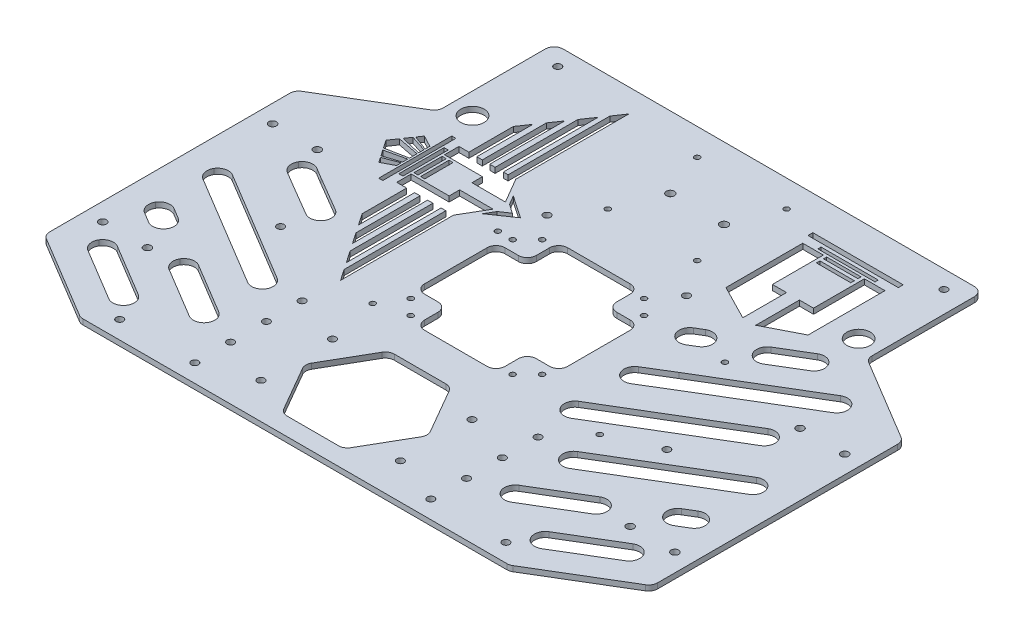
from build123d import *

# Parameters (mm, degrees)
SKETCH_1_W                  = 340
SKETCH_1_H                  = 265
EXTRUDE_1_DEPTH             = 3
HOLE_WIZARD_4_0_4_4_D       = 4
PATTERN_LINEAR_1_COUNT      = 4
PATTERN_LINEAR_1_PITCH      = 20
PATTERN_LINEAR_1_COUNT_DIR2 = 2
PATTERN_LINEAR_1_PITCH_DIR2 = 132
HOLE_WIZARD_4_2_4_2_1_D     = 4.2
PATTERN_LINEAR_2_COUNT      = 2
PATTERN_LINEAR_2_PITCH      = 95
PATTERN_LINEAR_2_COUNT_DIR2 = 2
PATTERN_LINEAR_2_PITCH_DIR2 = 25
MIRROR_1_COPY_1_D           = 4.2
MIRROR_1_COPY_2_D           = 4.2
MIRROR_1_COPY_3_D           = 4.2
HOLE_WIZARD_4_0_4_1_D       = 4
CUT_EXTRUDE_1_DEPTH         = 3
HOLE_WIZARD_4_0_4_2_D       = 4
CUT_EXTRUDE_2_DEPTH         = 3
HOLE_WIZARD_3_0_3_1_D       = 3
PATTERN_LINEAR_3_COUNT      = 2
PATTERN_LINEAR_3_PITCH      = 73.5
PATTERN_LINEAR_3_COUNT_DIR2 = 2
PATTERN_LINEAR_3_PITCH_DIR2 = 57
PATTERN_CIRCULAR_2_COUNT    = 2
PATTERN_CIRCULAR_2_ANGLE    = 90
PATTERN_CIRCULAR_2_COPY_1_D = 3
PATTERN_CIRCULAR_2_COPY_2_D = 3
PATTERN_CIRCULAR_2_COPY_3_D = 3
HOLE_WIZARD_3_0_3_2_D       = 3
PATTERN_LINEAR_4_COUNT      = 2
PATTERN_LINEAR_4_PITCH      = 50
PATTERN_LINEAR_4_COUNT_DIR2 = 2
PATTERN_LINEAR_4_PITCH_DIR2 = 50
HOLE_WIZARD_4_5_4_5_1_D     = 4.5
SKETCH_20_W                 = 2.304
SKETCH_20_H                 = 7.929183637
SKETCH_20_H_2               = 12.65440487
SKETCH_20_H_3               = 12.654404871
SKETCH_20_H_4               = 20.44628026
CUT_EXTRUDE_3_DEPTH         = 3
CUT_EXTRUDE_4_DEPTH         = 3
HOLE_WIZARD_4_0_4_3_D       = 4
PATTERN_LINEAR_5_COUNT      = 2
PATTERN_LINEAR_5_PITCH      = 40
MIRROR_5_COPY_1_D           = 4
PATTERN_LINEAR_6_COUNT      = 2
PATTERN_LINEAR_6_PITCH      = 160
MIRROR_6_COPY_1_D           = 4
MIRROR_6_COPY_2_D           = 4
HOLE_WIZARD_13_0_13_1_D     = 13
HOLE_WIZARD_3_0_3_3_D       = 3
PATTERN_LINEAR_7_COUNT      = 2
PATTERN_LINEAR_7_PITCH      = 127
PATTERN_LINEAR_7_COUNT_DIR2 = 2
PATTERN_LINEAR_7_PITCH_DIR2 = 70
SKETCH_29_W                 = 9.614339975
SKETCH_29_H                 = 1.991198393
SKETCH_29_W_2               = 9.614339974
SKETCH_29_H_2               = 1.777126463
SKETCH_29_W_3               = 15.997707498
SKETCH_29_H_3               = 1.813029874
SKETCH_29_W_4               = 15.997707497
SKETCH_29_W_5               = 25.261157005
SKETCH_29_H_4               = 2.747873401
CUT_EXTRUDE_5_DEPTH         = 3
CUT_EXTRUDE_2_2_DEPTH       = 3
FILLET_1_R                  = 6
FILLET_2_R                  = 5


with BuildPart() as part:
    # 草图1 → 凸台-拉伸1 (new body)
    with BuildSketch(Plane(origin=(0, 0, 0), x_dir=(1, 0, 0), z_dir=(0, 1, 0))):
        with Locations((0, 92.5)):
            Rectangle(SKETCH_1_W, SKETCH_1_H)
    extrude(amount=EXTRUDE_1_DEPTH)

    # Ø4.0 (4) 直径孔4 (through all)
    with Locations(Plane(origin=(0, 3, 0), x_dir=(1, 0, 0), z_dir=(0, 1, 0))):
        with Locations((66, -30)):
            hole_wizard_4_0_4_4 = Hole(HOLE_WIZARD_4_0_4_4_D / 2)

    # 阵列(线性)1: Hole Wizard 4.0 _4_ _4 4 × 2
    with Locations(*[(-j * PATTERN_LINEAR_1_PITCH_DIR2, 0, -i * PATTERN_LINEAR_1_PITCH) for i in range(PATTERN_LINEAR_1_COUNT) for j in range(PATTERN_LINEAR_1_COUNT_DIR2) if (i, j) != (0, 0)]):
        add(hole_wizard_4_0_4_4, mode=Mode.SUBTRACT)

    # Ø4.2 (4.2) 直径孔1 (through all)
    with Locations(Plane(origin=(0, 3, 0), x_dir=(1, 0, 0), z_dir=(0, 1, 0))):
        with Locations((160, 107.5)):
            hole_wizard_4_2_4_2_1 = Hole(HOLE_WIZARD_4_2_4_2_1_D / 2)

    # 阵列(线性)2: Hole Wizard 4.2 _4.2_ _1 2 × 2
    with Locations(*[(-j * PATTERN_LINEAR_2_PITCH_DIR2, 0, i * PATTERN_LINEAR_2_PITCH) for i in range(PATTERN_LINEAR_2_COUNT) for j in range(PATTERN_LINEAR_2_COUNT_DIR2) if (i, j) != (0, 0)]):
        add(hole_wizard_4_2_4_2_1, mode=Mode.SUBTRACT)

    # 镜向1: Ø4.2 (4.2) 直径孔1 across plane
    add(hole_wizard_4_2_4_2_1.mirror(Plane(origin=(0, 0, 0), x_dir=(0, 0, 1), z_dir=(1, 0, 0))), mode=Mode.SUBTRACT)

    # 镜向1 copy 1 (through all)
    with Locations(Plane(origin=(25, 3, 0), x_dir=(-1, 0, 0), z_dir=(0, 1, 0))):
        with Locations((160, -107.5)):
            Hole(MIRROR_1_COPY_1_D / 2)

    # 镜向1 copy 2 (through all)
    with Locations(Plane(origin=(0, 3, 95), x_dir=(-1, 0, 0), z_dir=(0, 1, 0))):
        with Locations((160, -107.5)):
            Hole(MIRROR_1_COPY_2_D / 2)

    # 镜向1 copy 3 (through all)
    with Locations(Plane(origin=(25, 3, 95), x_dir=(-1, 0, 0), z_dir=(0, 1, 0))):
        with Locations((160, -107.5)):
            Hole(MIRROR_1_COPY_3_D / 2)

    # Ø4.0 (4) 直径孔1 (through all)
    with Locations(Plane(origin=(0, 3, 0), x_dir=(1, 0, 0), z_dir=(0, 1, 0))):
        with Locations((108, -30), (108, 60)):
            hole_wizard_4_0_4_1 = Hole(HOLE_WIZARD_4_0_4_1_D / 2)

    # 镜向2: Ø4.0 (4) 直径孔1 across plane
    add(hole_wizard_4_0_4_1.mirror(Plane(origin=(0, 0, 0), x_dir=(0, 0, 1), z_dir=(1, 0, 0))), mode=Mode.SUBTRACT)

    # 草图8 → 切除-拉伸1 (cut)
    with BuildSketch(Plane(origin=(0, 3, 0), x_dir=(1, 0, 0), z_dir=(0, 1, 0))):
        Polygon((-170, -40), (-120, -40), (-170, -10), align=None)
        Polygon((-120, 160), (-120, 225), (-170, 225), (-170, 160), (-170, 130), align=None)
    cut_extrude_1 = extrude(amount=-CUT_EXTRUDE_1_DEPTH, mode=Mode.SUBTRACT)

    # 镜向3: 切除-拉伸1 across plane
    add(cut_extrude_1.mirror(Plane(origin=(0, 0, 0), x_dir=(0, 0, 1), z_dir=(1, 0, 0))), mode=Mode.SUBTRACT)

    # Ø4.0 (4) 直径孔2 (through all)
    with Locations(Plane(origin=(0, 3, 0), x_dir=(1, 0, 0), z_dir=(0, 1, 0))):
        with Locations((108, 215)):
            hole_wizard_4_0_4_2 = Hole(HOLE_WIZARD_4_0_4_2_D / 2)

    # 镜向4: Ø4.0 (4) 直径孔2 across plane
    add(hole_wizard_4_0_4_2.mirror(Plane(origin=(0, 0, 0), x_dir=(0, 0, 1), z_dir=(1, 0, 0))), mode=Mode.SUBTRACT)

    # 草图13 → Cut-Extrude 2 (cut)
    with BuildSketch(Plane(origin=(0, 3, 0), x_dir=(1, 0, 0), z_dir=(0, 1, 0))):
        Polygon((22.5, 50), (0, 50), (-22.5, 50), (-22.5, 130), (22.5, 130), align=None)
    cut_extrude_2 = extrude(amount=-CUT_EXTRUDE_2_DEPTH, mode=Mode.SUBTRACT)

    # Ø3.0 (3) 直径孔1 (through all)
    with Locations(Plane(origin=(0, 3, 0), x_dir=(1, 0, 0), z_dir=(0, 1, 0))):
        with Locations((28.5, 126.75)):
            hole_wizard_3_0_3_1 = Hole(HOLE_WIZARD_3_0_3_1_D / 2)

    # 阵列(线性)3: Hole Wizard 3.0 _3_ _1 2 × 2
    with Locations(*[(-j * PATTERN_LINEAR_3_PITCH_DIR2, 0, i * PATTERN_LINEAR_3_PITCH) for i in range(PATTERN_LINEAR_3_COUNT) for j in range(PATTERN_LINEAR_3_COUNT_DIR2) if (i, j) != (0, 0)]):
        add(hole_wizard_3_0_3_1, mode=Mode.SUBTRACT)

    # 阵列(圆周)2: Cut-Extrude 2, Ø3.0 (3) 直径孔1 ×2 about axis
    pattern_circular_2_axis = Axis((0, 0, -90), (0, 1, 0))
    add([cut_extrude_2.rotate(pattern_circular_2_axis, i * PATTERN_CIRCULAR_2_ANGLE / (PATTERN_CIRCULAR_2_COUNT - 1)) for i in range(1, PATTERN_CIRCULAR_2_COUNT)], mode=Mode.SUBTRACT)
    add([hole_wizard_3_0_3_1.rotate(pattern_circular_2_axis, i * PATTERN_CIRCULAR_2_ANGLE / (PATTERN_CIRCULAR_2_COUNT - 1)) for i in range(1, PATTERN_CIRCULAR_2_COUNT)], mode=Mode.SUBTRACT)

    # 阵列(圆周)2 copy 1 (through all)
    with Locations(Plane(origin=(90, 3, -33), x_dir=(0, 0, -1), z_dir=(0, 1, 0))):
        with Locations((28.5, 126.75)):
            Hole(PATTERN_CIRCULAR_2_COPY_1_D / 2)

    # 阵列(圆周)2 copy 2 (through all)
    with Locations(Plane(origin=(163.5, 3, -90), x_dir=(0, 0, -1), z_dir=(0, 1, 0))):
        with Locations((28.5, 126.75)):
            Hole(PATTERN_CIRCULAR_2_COPY_2_D / 2)

    # 阵列(圆周)2 copy 3 (through all)
    with Locations(Plane(origin=(163.5, 3, -33), x_dir=(0, 0, -1), z_dir=(0, 1, 0))):
        with Locations((28.5, 126.75)):
            Hole(PATTERN_CIRCULAR_2_COPY_3_D / 2)

    # Ø3.0 (3) 直径孔2 (through all)
    with Locations(Plane(origin=(0, 3, 0), x_dir=(1, 0, 0), z_dir=(0, 1, 0))):
        with Locations((-25, 210)):
            hole_wizard_3_0_3_2 = Hole(HOLE_WIZARD_3_0_3_2_D / 2)

    # 阵列(线性)4: Hole Wizard 3.0 _3_ _2 2 × 2
    with Locations(*[(j * PATTERN_LINEAR_4_PITCH_DIR2, 0, i * PATTERN_LINEAR_4_PITCH) for i in range(PATTERN_LINEAR_4_COUNT) for j in range(PATTERN_LINEAR_4_COUNT_DIR2) if (i, j) != (0, 0)]):
        add(hole_wizard_3_0_3_2, mode=Mode.SUBTRACT)

    # Ø4.5 (4.5) 直径孔1 (through all)
    with Locations(Plane(origin=(0, 3, 0), x_dir=(1, 0, 0), z_dir=(0, 1, 0))):
        with Locations((15, 185), (-15, 185)):
            Hole(HOLE_WIZARD_4_5_4_5_1_D / 2)

    # 草图20 → 切除-拉伸3 (cut)
    with BuildSketch(Plane(origin=(0, 3, 0), x_dir=(1, 0, 0), z_dir=(0, 1, 0))):
        Polygon((-65.161915682, 211.869982225), (-69.447641611, 205.611932631), (-69.447641611, 148.677537629), (-65.161915682, 148.677537629), align=None)
        Polygon((-75.708296812, 134.728942545), (-57.004498885, 134.728942545), (-65.161915682, 148.677537629), (-96.948202991, 148.677537629), (-96.948202991, 140.593692762), (-75.708296812, 140.593692762), align=None)
        Polygon((-65.161915682, 113.882056967), (-96.948202991, 113.882056967), (-96.948202991, 121.965901834), (-75.708296812, 121.965901834), (-75.708296812, 127.830652051), (-57.004498885, 127.830652051), align=None)
        Polygon((-49.125427231, 131.279797298), (-49.674785213, 131.279797298), (-54.711253333, 127.830652051), (-57.779878264, 122.62953623), (-45.148701269, 131.279797298), align=None)
        Polygon((-54.711253333, 134.728942545), (-49.674785213, 131.279797298), (-49.125427231, 131.279797298), (-45.148701269, 131.279797298), (-57.779878264, 139.930058366), align=None)
        Polygon((-72.126923578, 201.699624727), (-76.714154658, 195.001315019), (-76.714154658, 148.677537629), (-72.126923578, 148.677537629), align=None)
        Polygon((-79.701188849, 190.639624977), (-83.883036718, 184.533258918), (-83.883036718, 148.677537629), (-79.701188849, 148.677537629), align=None)
        Polygon((-86.955414743, 180.04694916), (-91.393294113, 173.566723954), (-91.393294113, 148.677537629), (-86.955414743, 148.677537629), align=None)
        Polygon((-91.393294113, 113.882056967), (-91.393294113, 88.992870642), (-86.955414743, 82.512645436), (-86.955414743, 113.882056967), align=None)
        Polygon((-83.883036718, 113.882056967), (-83.883036718, 78.026335678), (-79.701188849, 71.919969619), (-79.701188849, 113.882056967), align=None)
        Polygon((-76.714154658, 113.882056967), (-76.714154658, 67.558279577), (-72.126923578, 60.859969869), (-72.126923578, 113.882056967), align=None)
        Polygon((-69.447641611, 113.882056967), (-69.447641611, 56.947661965), (-65.161915682, 50.689612371), (-65.161915682, 113.882056967), align=None)
        with Locations((-91.914025093, 135.244389117)):
            Rectangle(SKETCH_20_W, SKETCH_20_H)
        with Locations((-91.914025093, 127.31520548)):
            Rectangle(SKETCH_20_W, SKETCH_20_H)
        with Locations((-99.360275881, 124.952594863)):
            Rectangle(SKETCH_20_W, SKETCH_20_H_2)
        with Locations((-99.360275881, 137.606999734)):
            Rectangle(SKETCH_20_W, SKETCH_20_H_3)
        with Locations((-102.854015262, 121.056657168)):
            Rectangle(SKETCH_20_W, SKETCH_20_H_4)
        with Locations((-102.854015262, 141.502937428)):
            Rectangle(SKETCH_20_W, SKETCH_20_H_4)
        Polygon((-111.626480361, 144.022071525), (-113.599808452, 141.14060284), (-105.122164665, 137.943905858), (-105.122164665, 140.601426815), align=None)
        Polygon((-114.21278578, 140.245528684), (-116.487410172, 136.924104848), (-105.122164665, 134.302998856), (-105.122164665, 137.261955913), align=None)
        Polygon((-120.352824605, 131.279797298), (-105.122164681, 131.279797298), (-105.122164681, 133.373561182), (-117.287622567, 135.755628624), align=None)
        Polygon((-105.122164681, 129.186033414), (-105.122164681, 131.279797298), (-120.352824605, 131.279797298), (-117.287622567, 126.803965972), align=None)
        Polygon((-105.122164665, 128.256595741), (-116.487410164, 125.635489753), (-114.21278578, 122.314065912), (-105.122164665, 125.297638683), align=None)
        Polygon((-105.122164665, 124.615688738), (-113.599808452, 121.418991756), (-111.626480361, 118.537523071), (-105.122164665, 121.958167781), align=None)
        with Locations((-95.683692637, 127.31520548)):
            Rectangle(SKETCH_20_W, SKETCH_20_H)
        with Locations((-95.683692637, 135.244389117)):
            Rectangle(SKETCH_20_W, SKETCH_20_H)
    extrude(amount=-CUT_EXTRUDE_3_DEPTH, mode=Mode.SUBTRACT)

    # 草图21 → 切除-拉伸4 (cut)
    with BuildSketch(Plane(origin=(0, 3, 0), x_dir=(1, 0, 0), z_dir=(0, 1, 0))):
        Polygon((34.641016151, 0), (17.320508076, 30), (-17.320508076, 30), (-34.641016151, 0), (-17.320508076, -30), (17.320508076, -30), align=None)
    extrude(amount=-CUT_EXTRUDE_4_DEPTH, mode=Mode.SUBTRACT)

    # Ø4.0 (4) 直径孔3 (through all)
    with Locations(Plane(origin=(0, 3, 0), x_dir=(1, 0, 0), z_dir=(0, 1, 0))):
        with Locations((39, -20)):
            hole_wizard_4_0_4_3 = Hole(HOLE_WIZARD_4_0_4_3_D / 2)

    # 阵列(线性)5: Ø4.0 (4) 直径孔3 ×2
    with Locations(*[(0, 0, -i * PATTERN_LINEAR_5_PITCH) for i in range(1, PATTERN_LINEAR_5_COUNT)]):
        add(hole_wizard_4_0_4_3, mode=Mode.SUBTRACT)

    # 镜向5: Ø4.0 (4) 直径孔3 across plane
    add(hole_wizard_4_0_4_3.mirror(Plane(origin=(0, 0, 0), x_dir=(0, 0, 1), z_dir=(1, 0, 0))), mode=Mode.SUBTRACT)

    # 镜向5 copy 1 (through all)
    with Locations(Plane(origin=(0, 3, -40), x_dir=(-1, 0, 0), z_dir=(0, 1, 0))):
        with Locations((39, 20)):
            Hole(MIRROR_5_COPY_1_D / 2)

    # 阵列(线性)6: Ø4.0 (4) 直径孔3 ×2
    with Locations(*[(0, 0, -i * PATTERN_LINEAR_6_PITCH) for i in range(1, PATTERN_LINEAR_6_COUNT)]):
        add(hole_wizard_4_0_4_3, mode=Mode.SUBTRACT)

    # 镜向6 copy 1 (through all)
    with Locations(Plane(origin=(0, 3, -160), x_dir=(-1, 0, 0), z_dir=(0, 1, 0))):
        with Locations((39, 20)):
            Hole(MIRROR_6_COPY_1_D / 2)

    # 镜向6 copy 2 (through all)
    with Locations(Plane(origin=(0, 3, 0), x_dir=(-1, 0, 0), z_dir=(0, 1, 0))):
        with Locations((39, 20)):
            Hole(MIRROR_6_COPY_2_D / 2)

    # Ø13.0 (13) 直径孔1 (through all)
    with Locations(Plane(origin=(0, 3, 0), x_dir=(1, 0, 0), z_dir=(0, 1, 0))):
        with Locations((-108, 167.3)):
            hole_wizard_13_0_13_1 = Hole(HOLE_WIZARD_13_0_13_1_D / 2)

    # 镜向7: Ø13.0 (13) 直径孔1 across plane
    add(hole_wizard_13_0_13_1.mirror(Plane(origin=(0, 0, 0), x_dir=(0, 0, 1), z_dir=(1, 0, 0))), mode=Mode.SUBTRACT)

    # Ø3.0 (3) 直径孔3 (through all)
    with Locations(Plane(origin=(0, 3, 0), x_dir=(1, 0, 0), z_dir=(0, 1, 0))):
        with Locations((-45, 118.5)):
            hole_wizard_3_0_3_3 = Hole(HOLE_WIZARD_3_0_3_3_D / 2)

    # 阵列(线性)7: Hole Wizard 3.0 _3_ _3 2 × 2
    with Locations(*[(i * PATTERN_LINEAR_7_PITCH, 0, j * PATTERN_LINEAR_7_PITCH_DIR2) for i in range(PATTERN_LINEAR_7_COUNT) for j in range(PATTERN_LINEAR_7_COUNT_DIR2) if (i, j) != (0, 0)]):
        add(hole_wizard_3_0_3_3, mode=Mode.SUBTRACT)

    # 草图29 → 切除-拉伸5 (cut)
    with BuildSketch(Plane(origin=(0, 3, 0), x_dir=(1, 0, 0), z_dir=(0, 1, 0))):
        Polygon((72.691668195, 169.494821887), (72.691668195, 145.036075879), (92.064932359, 154.964873764), (92.064932359, 197.949303628), (80.562056761, 197.949303628), (80.562056761, 169.494821887), align=None)
        Polygon((46.091443896, 154.964873764), (46.091443896, 197.949303628), (57.594319494, 197.949303628), (57.594319494, 169.494821887), (65.464708061, 169.494821887), (65.464708061, 145.036075879), align=None)
        with Locations((64.271018141, 193.196665814)):
            Rectangle(SKETCH_29_W, SKETCH_29_H)
        with Locations((73.885358115, 193.196665814)):
            Rectangle(SKETCH_29_W_2, SKETCH_29_H)
        with Locations((73.885358115, 197.060740397)):
            Rectangle(SKETCH_29_W_2, SKETCH_29_H_2)
        with Locations((64.271018141, 197.060740397)):
            Rectangle(SKETCH_29_W, SKETCH_29_H_2)
        with Locations((61.079334379, 200.300217856)):
            Rectangle(SKETCH_29_W_3, SKETCH_29_H_3)
        with Locations((77.077041877, 200.300217856)):
            Rectangle(SKETCH_29_W_4, SKETCH_29_H_3)
        with Locations((81.708766631, 204.507013734)):
            Rectangle(SKETCH_29_W_5, SKETCH_29_H_4)
        with Locations((56.447609626, 204.507013734)):
            Rectangle(SKETCH_29_W_5, SKETCH_29_H_4)
    extrude(amount=-CUT_EXTRUDE_5_DEPTH, mode=Mode.SUBTRACT)

    # 草图35 → Cut-Extrude 2 2 (cut)
    with BuildSketch(Plane(origin=(0, 3, 0), x_dir=(1, 0, 0), z_dir=(0, 1, 0))):
        Polygon((149.289050759, 7.894380308), (144.706679502, 5.144957554), (119.237536666, -10.136528147), (109.711275714, -15.852284718), (115.88522478, -26.142199827), (125.411485731, -20.426443256), (150.880628567, -5.144957554), (155.462999824, -2.3955348), align=None)
        Polygon((84.973005474, -12.036200799), (123.560187131, 11.116108195), (117.386238066, 21.406023304), (78.799056408, -1.746285691), align=None)
        Polygon((151.720036271, 74.659632838), (121.215178407, 56.35671812), (78.799056408, 30.907044921), (84.973005474, 20.617129812), (127.389127472, 46.066803011), (157.893985336, 64.36971773), align=None)
        Polygon((141.795008624, 22.057001091), (157.893985336, 31.716387118), (151.720036271, 42.006302227), (135.621059559, 32.3469162), align=None)
        Polygon((61.043493643, 45.326469941), (126.764003744, 84.758776002), (137.474694879, 91.185190683), (131.300745814, 101.475105791), (120.590054679, 95.04869111), (54.869544578, 55.61638505), align=None)
        Polygon((135.621059559, 137.689997296), (123.991330618, 130.712159931), (96.343698757, 114.123580815), (74.085335875, 100.768563085), (54.82901061, 89.006962889), (61.08402761, 78.766124919), (80.299915801, 90.503026493), (102.517647823, 103.833665706), (130.165279683, 120.422244822), (141.795008624, 127.400082187), align=None)
        Polygon((57.602980489, 113.022856021), (72.008861641, 121.666384712), (65.834912576, 131.956299821), (51.429031424, 123.31277113), align=None)
        Polygon((88.55677931, 125.39581952), (115.066971876, 141.30193506), (108.893022811, 151.591850168), (82.382830244, 135.685734628), align=None)
        Polygon((-95.662009122, 80.393940838), (-120.613077507, 95.062504808), (-131.300745814, 101.475105791), (-137.474694879, 91.185190683), (-126.740980915, 84.744962305), (-101.743621466, 70.049184133), align=None)
        Polygon((-78.799056408, 30.907044921), (-121.215178407, 56.35671812), (-151.720036271, 74.659632838), (-157.893985336, 64.36971773), (-127.389127472, 46.066803011), (-84.973005474, 20.617129812), align=None)
        Polygon((-135.621059559, 32.3469162), (-151.720036271, 42.006302227), (-157.893985336, 31.716387118), (-141.795008624, 22.057001091), align=None)
        Polygon((-78.799056408, -1.746285691), (-117.386238066, 21.406023304), (-123.560187131, 11.116108195), (-84.973005474, -12.036200799), align=None)
        Polygon((-109.711275714, -15.852284718), (-119.237536666, -10.136528147), (-144.706679502, 5.144957554), (-149.289050759, 7.894380308), (-155.462999824, -2.3955348), (-150.880628567, -5.144957554), (-125.411485731, -20.426443256), (-115.88522478, -26.142199827), align=None)
    extrude(amount=-CUT_EXTRUDE_2_2_DEPTH, mode=Mode.SUBTRACT)

    # 圆角1
    fillet_1_edges = [part.edges().sort_by_distance(p)[0] for p in [
        (157.893985336, 1.5, -64.36971773),
        (151.720036271, 1.5, -42.006302227),
        (135.621059559, 1.5, -32.3469162),
        (141.795008624, 1.5, -22.057001091),
        (149.289050759, 1.5, -7.894380308),
        (155.462999824, 1.5, 2.3955348),
        (84.973005474, 1.5, 12.036200799),
        (78.799056408, 1.5, 1.746285691),
        (84.973005474, 1.5, -20.617129812),
        (78.799056408, 1.5, -30.907044921),
        (57.602980489, 1.5, -113.022856021),
        (51.429031424, 1.5, -123.31277113),
        (61.043493643, 1.5, -45.326469941),
        (54.869544578, 1.5, -55.61638505),
        (61.08402761, 1.5, -78.766124919),
        (54.82901061, 1.5, -89.006962889),
        (88.55677931, 1.5, -125.39581952),
        (82.382830244, 1.5, -135.685734628),
        (-155.462999824, 1.5, 2.3955348),
        (-149.289050759, 1.5, -7.894380308),
        (-78.799056408, 1.5, 1.746285691),
        (-84.973005474, 1.5, 12.036200799),
        (-135.621059559, 1.5, -32.3469162),
        (-141.795008624, 1.5, -22.057001091),
        (-157.893985336, 1.5, -64.36971773),
        (-151.720036271, 1.5, -74.659632838),
        (-95.662009122, 1.5, -80.393940838),
        (-101.743621466, 1.5, -70.049184133),
        (123.560187131, 1.5, -11.116108195),
        (157.893985336, 1.5, -31.716387118),
        (115.88522478, 1.5, 26.142199827),
        (109.711275714, 1.5, 15.852284718),
        (117.386238066, 1.5, -21.406023304),
        (151.720036271, 1.5, -74.659632838),
        (65.834912576, 1.5, -131.956299821),
        (72.008861641, 1.5, -121.666384712),
        (131.300745814, 1.5, -101.475105791),
        (137.474694879, 1.5, -91.185190683),
        (135.621059559, 1.5, -137.689997296),
        (141.795008624, 1.5, -127.400082187),
        (108.893022811, 1.5, -151.591850168),
        (115.066971876, 1.5, -141.30193506),
        (-109.711275714, 1.5, 15.852284718),
        (-115.88522478, 1.5, 26.142199827),
        (-123.560187131, 1.5, -11.116108195),
        (-117.386238066, 1.5, -21.406023304),
        (-157.893985336, 1.5, -31.716387118),
        (-151.720036271, 1.5, -42.006302227),
        (-78.799056408, 1.5, -30.907044921),
        (-84.973005474, 1.5, -20.617129812),
        (-137.474694879, 1.5, -91.185190683),
        (-131.300745814, 1.5, -101.475105791),
    ]]
    fillet(fillet_1_edges, radius=FILLET_1_R - 0.0001)  # a hair under: the kernel refuses the full size

    # 圆角2
    fillet_2_edges = [part.edges().sort_by_distance(p)[0] for p in [
        (-170, 1.5, -130),
        (-120, 1.5, -225),
        (-120, 1.5, -160),
        (170, 1.5, 10),
        (120, 1.5, 40),
        (170, 1.5, -130),
        (120, 1.5, -160),
        (120, 1.5, -225),
        (22.5, 1.5, -50),
        (-22.5, 1.5, -50),
        (-22.5, 1.5, -130),
        (22.5, 1.5, -130),
        (22.5, 1.5, -112.5),
        (22.5, 1.5, -67.5),
        (-22.5, 1.5, -67.5),
        (-22.5, 1.5, -112.5),
        (-40, 1.5, -112.5),
        (40, 1.5, -112.5),
        (40, 1.5, -67.5),
        (-40, 1.5, -67.5),
        (17.320508076, 1.5, 30),
        (-17.320508076, 1.5, 30),
        (-34.641016151, 1.5, 0),
        (-17.320508076, 1.5, -30),
        (17.320508076, 1.5, -30),
        (34.641016151, 1.5, 0),
        (-170, 1.5, 10),
        (-120, 1.5, 40),
    ]]
    fillet(fillet_2_edges, radius=FILLET_2_R)


solid = part.part
